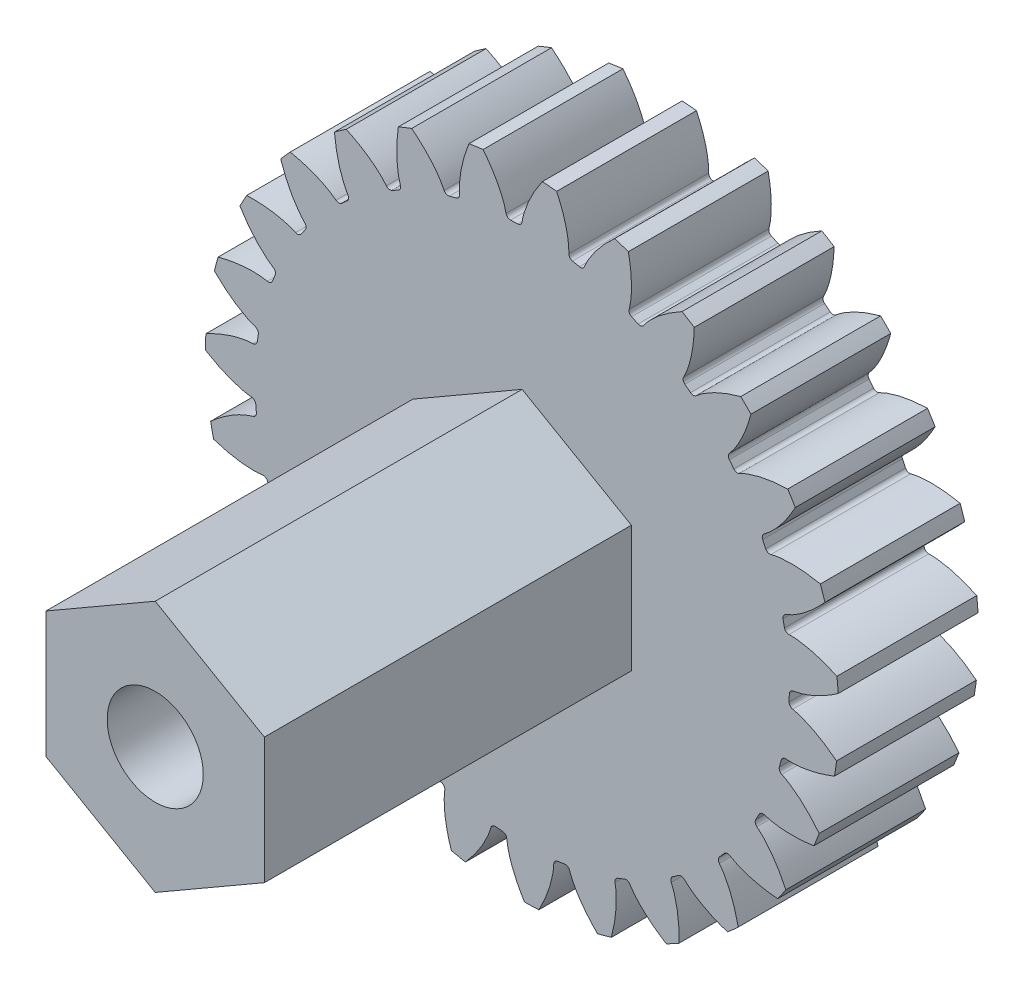
from build123d import *

# Parameters (mm, degrees)
SKETCH2_R                = 18.125
BOSS_EXTRUDE1_DEPTH      = 8
CUT_EXTRUDE1_DEPTH       = 8
FILLET1_R                = 0.254
CIRPATTERN3_COUNT        = 27
FILLET1_OF_CIRPATTERN3_R = 0.254
BOSS_EXTRUDE3_DEPTH      = 21
SKETCH6_R                = 2.75
CUT_EXTRUDE2_DEPTH       = 39.70405817


# Read off the part's stored shape, not the designer's step: Cut-Extrude1
with BuildPart() as part:
    # Sketch2 → Boss-Extrude1 (new body)
    with BuildSketch(Plane.XY):
        Circle(SKETCH2_R)
    extrude(amount=BOSS_EXTRUDE1_DEPTH)

    # Cut-Extrude1 outline → Cut-Extrude1 (cut)
    with BuildSketch(Plane.XY):
        with BuildLine():
            add(Edge.make_bspline(
                [(15.293943906, 0), (15.305253299, 0), (15.336964339, 0.00074082), (15.396845119, 0.005066139), (15.494240284, 0.016267993), (15.617714722, 0.036610689), (15.776289364, 0.069834677), (15.961506744, 0.117828662), (16.163035486, 0.179773153), (16.379749283, 0.256988095), (16.59342961, 0.342624014), (16.803983292, 0.435958219), (17.011216032, 0.536009953), (17.259008351, 0.665439426), (17.551466226, 0.832023435), (17.793413557, 0.984652677), (17.98203981, 1.112094263), (18.081230118, 1.181579697), (18.086216109, 1.185078834)],
                knots=[0, 0, 0, 0, 0, 0.005376748, 0.015083688, 0.02853182, 0.046610139, 0.064854849, 0.092110525, 0.119476175, 0.146842495, 0.174208853, 0.201574955, 0.228941013, 0.256307345, 0.307035032, 0.361767351, 0.364665932, 0.364665932, 0.364665932, 0.364665932, 0.364665932], degree=4))
            Line((15.293943906, 0), (15.269621682, -0.86219134))
            add(Edge.make_bspline(
                [(17.990644834, -2.202799001), (17.985864036, -2.199024345), (17.890748691, -2.124057592), (17.709606894, -1.986184932), (17.476648761, -1.820158714), (17.194047109, -1.637352405), (16.953945405, -1.49415955), (16.752682616, -1.382584249), (16.547725468, -1.277528577), (16.339212659, -1.179982683), (16.127196474, -1.090673365), (15.929480328, -1.017466265), (15.747263149, -0.959107033), (15.590813683, -0.916996286), (15.468682422, -0.889725108), (15.372073647, -0.873050446), (15.312531935, -0.865356246), (15.280913089, -0.862828904), (15.269621682, -0.86219134)],
                knots=[0.544424984, 0.544424984, 0.544424984, 0.544424984, 0.544424984, 0.547323565, 0.602055884, 0.652783571, 0.680149903, 0.707515961, 0.734882063, 0.762248421, 0.789614741, 0.816980391, 0.844236067, 0.862480777, 0.880559096, 0.894007228, 0.903714168, 0.909090916, 0.909090916, 0.909090916, 0.909090916, 0.909090916], degree=4))
            ThreePointArc((17.990644834, -2.202799001), (18.117792441, -0.511098867), (18.086216109, 1.185078834))
        make_face()
    cut_extrude1 = extrude(amount=CUT_EXTRUDE1_DEPTH, mode=Mode.SUBTRACT)

    # Fillet1
    fillet1_edges = [part.edges().sort_by_distance(p)[0] for p in [
        (15.269621682, -0.86219134, 4),
        (15.293943906, 0, 4),
    ]]
    fillet(fillet1_edges, radius=FILLET1_R)

    # CirPattern3: Cut-Extrude1 ×27 about axis
    cirpattern3_axis = Axis((0, 0, 18.908609159), (0, 0, -1))
    for i in range(1, CIRPATTERN3_COUNT):
        add(cut_extrude1.rotate(cirpattern3_axis, i * 360 / CIRPATTERN3_COUNT), mode=Mode.SUBTRACT)

    # Fillet1 of CirPattern3
    fillet1_of_cirpattern3_edges = [part.edges().sort_by_distance(p)[0] for p in [
        (14.659192047, -4.360367961, 4),
        (14.881693669, -3.527026191, 4),
        (13.258481574, -7.623476016, 4),
        (13.667167474, -6.863909487, 4),
        (11.143002927, -10.475600507, 4),
        (11.715840743, -9.830757646, 4),
        (8.426802109, -12.762982662, 4),
        (9.132910004, -12.267627116, 4),
        (5.256310208, -14.362309119, 4),
        (6.057621724, -14.043145632, 4),
        (1.802449263, -15.187359773, 4),
        (2.655765489, -15.061594533, 4),
        (-1.748582189, -15.193655931, 4),
        (-0.889263752, -15.268068974, 4),
        (-5.205347122, -14.380858165, 4),
        (-4.386352553, -14.651437864, 4),
        (-8.381490444, -12.792784613, 4),
        (-7.646971953, -13.244943947, 4),
        (-11.105785447, -10.515048731, 4),
        (-10.495341116, -11.124411673, 4),
        (-13.231364682, -7.67044385, 4),
        (-12.777903722, -8.404159486, 4),
        (-14.643637622, -4.412323356, 4),
        (-14.371606231, -5.230836887, 4),
        (-15.266468268, -0.916333368, 4),
        (-15.190531729, -1.775518517, 4),
        (-15.066279658, 2.629056389, 4),
        (-15.190531729, 1.775518517, 4),
        (-14.053864011, 6.032713036, 4),
        (-14.371606231, 5.230836887, 4),
        (-12.283800918, 9.111144562, 4),
        (-12.777903722, 8.404159486, 4),
        (-9.851514938, 11.698391926, 4),
        (-10.495341116, 11.124411673, 4),
        (-6.888131238, 13.654975953, 4),
        (-7.646971953, 13.244943947, 4),
        (-3.553406599, 14.875416692, 4),
        (-4.386352553, 14.651437864, 4),
        (-0.027116892, 15.293919867, 4),
        (-0.889263752, 15.268068974, 4),
        (3.500634695, 14.887923863, 4),
        (2.655765489, 15.061594533, 4),
        (6.839666159, 13.67931603, 4),
        (6.057621724, 14.043145632, 4),
        (9.80996945, 11.733252729, 4),
        (9.132910004, 12.267627116, 4),
        (12.251414749, 9.154646737, 4),
        (11.715840743, 9.830757646, 4),
        (14.032383107, 6.082511369, 4),
        (13.667167474, 6.863909487, 4),
        (15.05686206, 2.682466239, 4),
        (14.881693669, 3.527026191, 4),
    ]]
    fillet(fillet1_of_cirpattern3_edges, radius=FILLET1_OF_CIRPATTERN3_R)

    # Sketch5 → Boss-Extrude3 (add)
    with BuildSketch(Plane.XY.offset(8)):
        Polygon((0, -7.216878365), (6.25, -3.608439182), (6.25, 3.608439182), (0, 7.216878365), (-6.25, 3.608439182), (-6.25, -3.608439182), align=None)
    extrude(amount=BOSS_EXTRUDE3_DEPTH)

    # Sketch6 → Cut-Extrude2 (cut, through all)
    with BuildSketch(Plane.XY.offset(29)):
        Circle(SKETCH6_R)
    extrude(amount=-CUT_EXTRUDE2_DEPTH, mode=Mode.SUBTRACT)


solid = part.part
